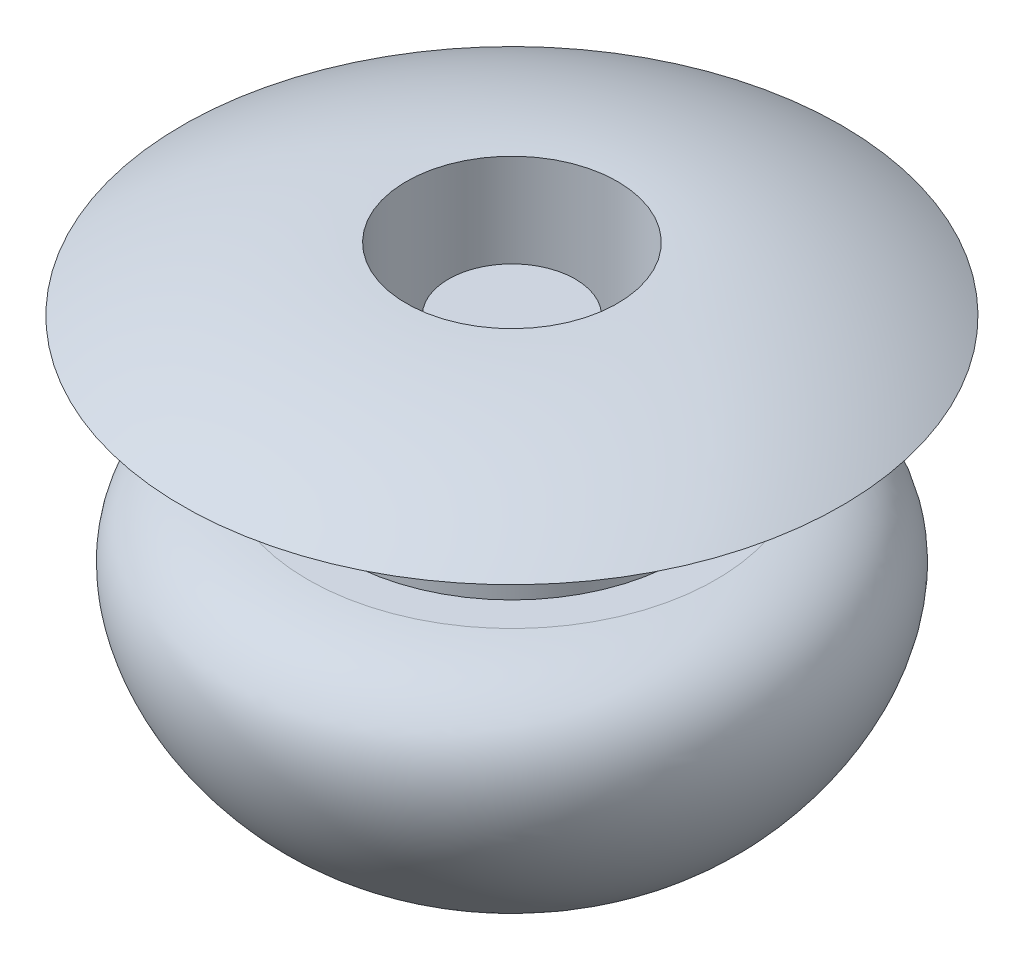
from build123d import *


with BuildPart() as part:
    # Szkic1 → Obrót1 (revolve)
    with BuildSketch(Plane(origin=(0, 0, 0), x_dir=(0, 0, -1), z_dir=(1, 0, 0))):
        with BuildLine():
            Line((0, 0), (-0.75, 0))
            Line((-0.75, 0), (-0.75, -1.700737467))
            Line((-0.75, -1.700737467), (-1.25, -1.700737467))
            Line((-1.25, -1.700737467), (-1.25, 0.75))
            ThreePointArc((-1.25, 0.75), (-2.627043935, 0.558888572), (-3.9, 0))
            Line((-3.9, 0), (-2, 0))
            Line((-2, 0), (-2, -1.499998944))
            Line((-2, -1.499998944), (-2.413891755, -1.499998944))
            add(Edge.make_bspline(
                [(-2.413891755, -1.499998944), (-3.867503112, -1.669656265), (-3.528877649, -3.80201257), (-1.083961642, -5.373531312), (-0.271752618, -3.374948241), (-0.956030427, -3.078928137)],
                knots=[0, 0, 0, 0, 0.464993082, 0.721927553, 1, 1, 1, 1], degree=3))
            add(Edge.make_bspline(
                [(-0.956030427, -3.078928137), (-0.520263876, -3.200737467), (0, -3.200737467)],
                knots=[0.992852221, 0.992852221, 0.992852221, 1.570796327, 1.570796327, 1.570796327], degree=2, weights=[1, 0.958537313, 1]))
            Line((0, -3.200737467), (0, -1.700737467))
            Line((0, -1.700737467), (0, 0))
        make_face()
    revolve(axis=Axis((0, 0, 0), (0, 1, 0)))


solid = part.part
